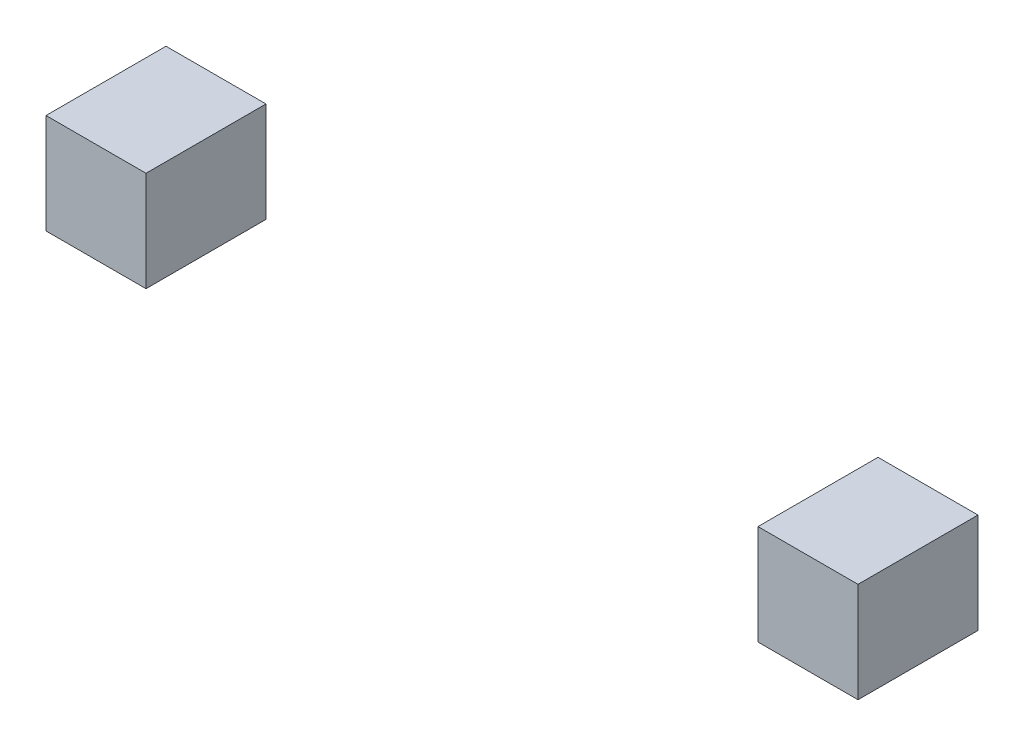
from build123d import *

# Parameters (mm, degrees)
SKETCH1_W             = 75
SKETCH1_H             = 75
BOSS_EXTRUDE1_DEPTH   = 90
BOSS_EXTRUDE1_2_DEPTH = 90


with BuildPart() as part:
    # Sketch1 → Boss-Extrude1 (new body)
    with BuildSketch(Plane.XY):
        with Locations((267.5, 672.77)):
            Rectangle(SKETCH1_W, SKETCH1_H)
    extrude(amount=BOSS_EXTRUDE1_DEPTH)


with BuildPart() as body_2:
    # Sketch1 → Boss-Extrude1 2 (new body)
    with BuildSketch(Plane.XY):
        with Locations((-266.5, 672.77)):
            Rectangle(SKETCH1_W, SKETCH1_H)
    extrude(amount=BOSS_EXTRUDE1_2_DEPTH)


solid = Compound([part.part, body_2.part])
